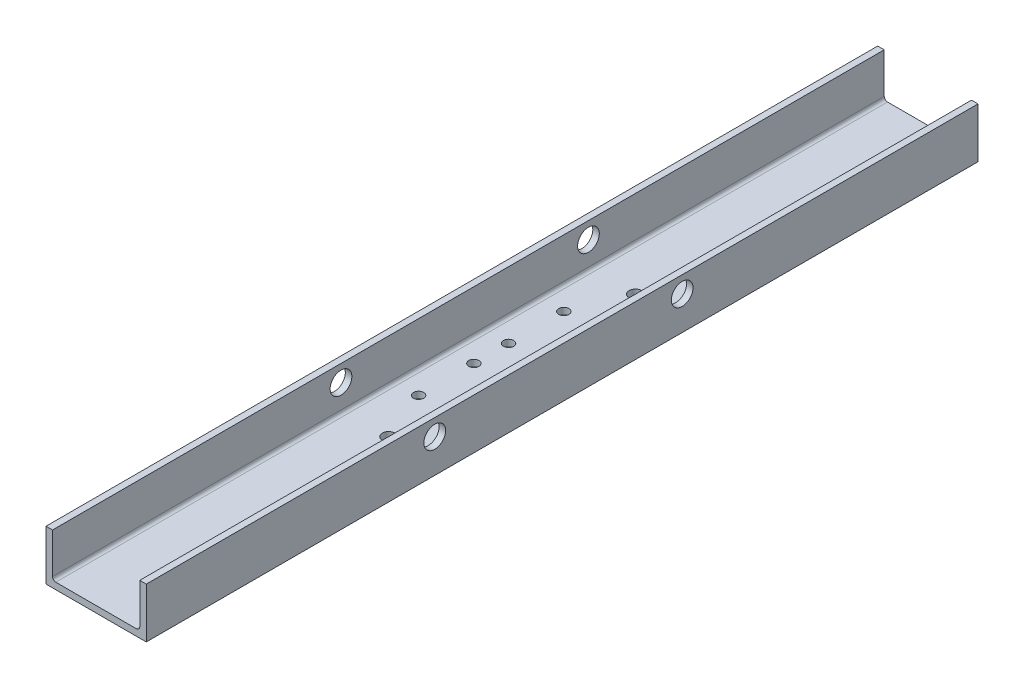
from build123d import *

# Parameters (mm, degrees)
BOSS_EXTRUDE1_DEPTH = 210.695
FILLET1_R           = 1.651
SKETCH4_R           = 2.585
CUT_EXTRUDE1_DEPTH  = 10
SKETCH5_R           = 3.18
CUT_EXTRUDE2_DEPTH  = 214.367909089
SKETCH6_R           = 5.5
CUT_EXTRUDE3_DEPTH  = 217.35557083
SKETCH7_R           = 5.5
CUT_EXTRUDE4_DEPTH  = 218.104382786


with BuildPart() as part:
    # Sketch3 → Boss-Extrude1 (new, symmetric)
    with BuildSketch(Plane.XY):
        Polygon((-25.4, 12.7), (-25.4, -12.7), (25.4, -12.7), (25.4, 12.7), (22.098, 12.7), (22.098, -9.398), (-22.098, -9.398), (-22.098, 12.7), align=None)
    extrude(amount=BOSS_EXTRUDE1_DEPTH, both=True)

    # Fillet1
    fillet1_edges = [part.edges().sort_by_distance(p)[0] for p in [
        (22.098, -9.398, 0),
        (-22.098, -9.398, 0),
    ]]
    fillet(fillet1_edges, radius=FILLET1_R)

    # Sketch4 → Cut-Extrude1 (cut)
    with BuildSketch(Plane(origin=(0, -9.398, 0), x_dir=(1, 0, 0), z_dir=(0, 1, 0))):
        with Locations((-10.530435142, 8.79)):
            Circle(SKETCH4_R)
        with Locations((10.469564858, 8.79)):
            Circle(SKETCH4_R)
        with Locations((-10.530435142, 36.79)):
            Circle(SKETCH4_R)
        with Locations((10.469564858, 36.79)):
            Circle(SKETCH4_R)
        with Locations((-10.530435142, -36.79)):
            Circle(SKETCH4_R)
        with Locations((10.469564858, -36.79)):
            Circle(SKETCH4_R)
        with Locations((10.469564858, -8.79)):
            Circle(SKETCH4_R)
        with Locations((-10.530435142, -8.79)):
            Circle(SKETCH4_R)
    extrude(amount=-CUT_EXTRUDE1_DEPTH, mode=Mode.SUBTRACT)

    # Sketch5 → Cut-Extrude2 (cut, through all)
    with BuildSketch(Plane(origin=(0, -9.398, 0), x_dir=(1, 0, 0), z_dir=(0, 1, 0))):
        with Locations((0, 62.521391607)):
            Circle(SKETCH5_R)
        with Locations((0, -62.52)):
            Circle(SKETCH5_R)
    extrude(amount=-CUT_EXTRUDE2_DEPTH, mode=Mode.SUBTRACT)

    # Sketch6 → Cut-Extrude3 (cut, through all)
    with BuildSketch(Plane.ZY.offset(-22.098)):
        with Locations((64.543631174, 4.26500546)):
            Circle(SKETCH6_R)
        with Locations((-60.827499788, 4.264871568)):
            Circle(SKETCH6_R)
    extrude(amount=-CUT_EXTRUDE3_DEPTH, mode=Mode.SUBTRACT)

    # Sketch7 → Cut-Extrude4 (cut, through all)
    with BuildSketch(Plane.ZY.offset(25.4)):
        with Locations((64.543631174, 4.26500546)):
            Circle(SKETCH7_R)
        with Locations((-60.827499788, 4.264871568)):
            Circle(SKETCH7_R)
    extrude(amount=-CUT_EXTRUDE4_DEPTH, mode=Mode.SUBTRACT)


solid = part.part
